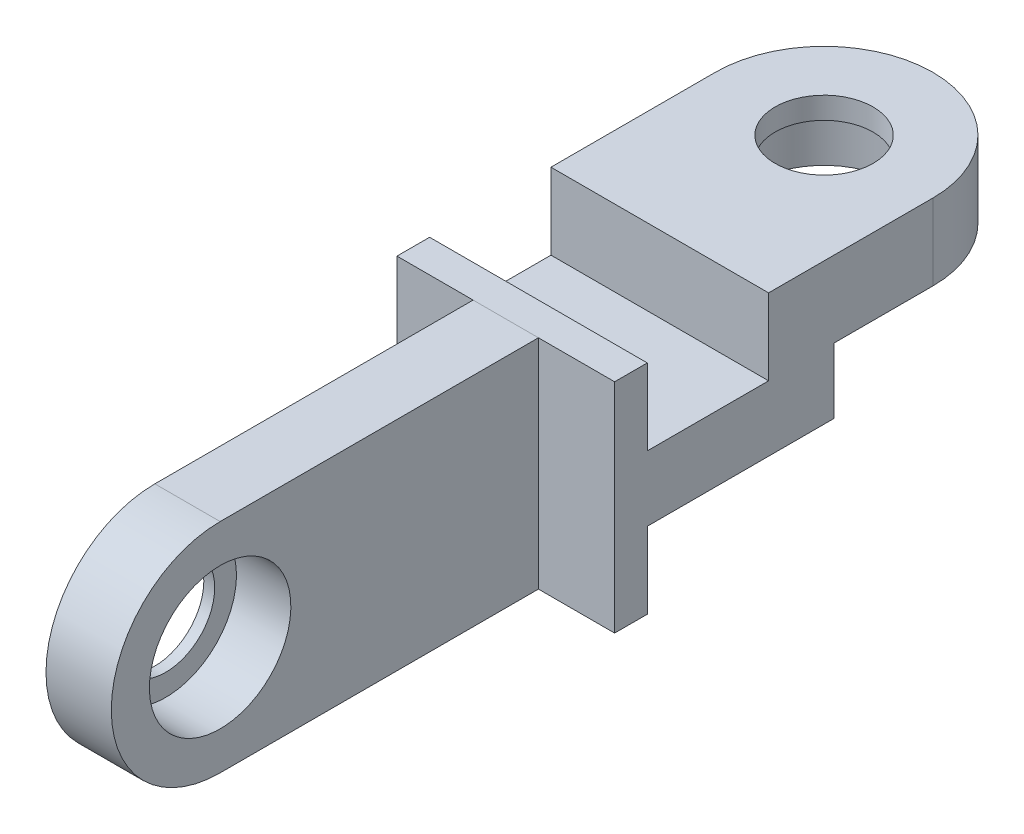
from build123d import *

# Parameters (mm, degrees)
SKETCH_1_W          = 20
SKETCH_1_H          = 20
EXTRUDE_1_DEPTH     = 80.297387422
SKETCH_7_W          = 11.148693711
SKETCH_7_H          = 7
CUT_EXTRUDE_6_DEPTH = 34
SKETCH_2_R          = 6.5
CUT_EXTRUDE_1_DEPTH = 5
SKETCH_3_R          = 4.5
CUT_EXTRUDE_2_DEPTH = 29
MOVE_BODY_1_ANGLE   = 90
SKETCH_9_W          = 7
SKETCH_9_H          = 39.245987558
CUT_EXTRUDE_7_DEPTH = 34
SKETCH_10_R         = 6.5
CUT_EXTRUDE_8_DEPTH = 5


# Read off the part's stored shape, not the designer's step: 교차3
with BuildPart() as part:
    # 스케치1 → 보스-돌출1 (new body)
    with BuildSketch(Plane.XY):
        Rectangle(SKETCH_1_W, SKETCH_1_H)
    extrude(amount=EXTRUDE_1_DEPTH)

    # 스케치7 → 컷-돌출6 (cut)
    with BuildSketch(Plane(origin=(10, 0, 0), x_dir=(0, 0, -1), z_dir=(1, 0, 0))):
        Polygon((-20, -3), (-20, 3), (0, 3), (0, -3), (0, -10), (-37.148693711, -10), (-37.148693711, -3), align=None)
        with Locations((-31.574346855, 6.5)):
            Rectangle(SKETCH_7_W, SKETCH_7_H)
    extrude(amount=-CUT_EXTRUDE_6_DEPTH, mode=Mode.SUBTRACT)

    # 스케치2 → 컷-돌출1 (cut)
    with BuildSketch(Plane(origin=(0, 3, 0), x_dir=(-1, 0, 0), z_dir=(0, -1, 0))):
        with Locations(Location((0, -10.902706153, 0), (0, 0, 90))):
            Circle(SKETCH_2_R)
    cut_extrude_1 = extrude(amount=-CUT_EXTRUDE_1_DEPTH, mode=Mode.SUBTRACT)

    # 스케치3 → 컷-돌출2 (cut)
    with BuildSketch(Plane(origin=(0, -10, 0), x_dir=(-1, 0, 0), z_dir=(0, -1, 0))):
        with Locations(Location((0, -10.902706153, 0), (0, 0, 90))):
            Circle(SKETCH_3_R)
        with BuildLine():
            Line((-21.262122506, -10.902706153), (-10, -10.902706153))
            ThreePointArc((-10, -10.902706153), (0, -0.902706153), (10, -10.902706153))
            Line((10, -10.902706153), (21.262122506, -10.902706153))
            ThreePointArc((21.262122506, -10.902706153), (0, 10.359416353), (-21.262122506, -10.902706153))
        make_face()
    cut_extrude_2 = extrude(amount=-CUT_EXTRUDE_2_DEPTH, mode=Mode.SUBTRACT)

    # 대칭 복사6: 컷-돌출1, 컷-돌출2 across plane
    add(cut_extrude_1.mirror(Plane.XY.offset(40.148693711)), mode=Mode.SUBTRACT)
    add(cut_extrude_2.mirror(Plane.XY.offset(40.148693711)), mode=Mode.SUBTRACT)


with BuildPart() as body_2:
    # 교차3: the piece on the far side of the plane
    add(part.part)
    split(bisect_by=Plane.XY.offset(40.148693711), keep=Keep.BOTTOM)


with BuildPart() as part_1:
    add(part.part)

    # 교차3
    split(bisect_by=Plane.XY.offset(40.148693711), keep=Keep.TOP)


with BuildPart() as part_2:
    # Move Body 1: moved
    add(part_1.part.rotate(Axis((0, 0, 0), (0, 0, 1)), MOVE_BODY_1_ANGLE))

    # 스케치9 → 컷-돌출7 (cut)
    with BuildSketch(Plane.XZ.offset(10)):
        with Locations((6.5, 59.77168749)):
            Rectangle(SKETCH_9_W, SKETCH_9_H)
        with Locations((-6.5, 59.77168749)):
            Rectangle(SKETCH_9_W, SKETCH_9_H)
    extrude(amount=-CUT_EXTRUDE_7_DEPTH, mode=Mode.SUBTRACT)

    # 스케치10 → 컷-돌출8 (cut)
    with BuildSketch(Plane(origin=(3, 0, 0), x_dir=(0, 0, -1), z_dir=(1, 0, 0))):
        with Locations(Location((-69.394681269, 0, 0), (0, 0, 90))):
            Circle(SKETCH_10_R)
    extrude(amount=-CUT_EXTRUDE_8_DEPTH, mode=Mode.SUBTRACT)


solid = Compound([body_2.part, part_2.part])
